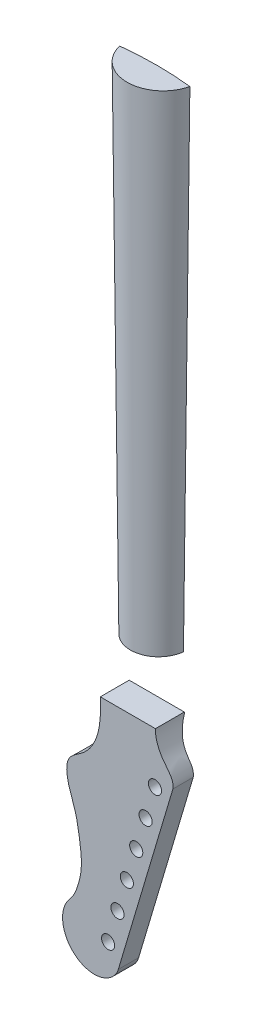
from build123d import *

# Parameters (mm, degrees)
SKETCH7_R               = 5
BOSS_EXTRUDE1_DEPTH     = 22
CUT_EXTRUDE1_DEPTH      = 89
CUT_EXTRUDE1_DEPTH_BACK = 47
FILLET1_R               = 35
FILLET2_START           = 6
FILLET2_DEPTH           = 17


with BuildPart() as part:
    # Sketch4 for Loft1 → Loft1 section 0
    with BuildSketch(Plane(origin=(0, 413.03, 0), x_dir=(1, 0, 0), z_dir=(0, 1, 0))):
        with BuildLine():
            # circular arc as an exact rational Bezier (weights 1, cos(half-angle), 1)
            Bezier((3.411173818, -1.486067363), (30.150054, 1.495276154), (56.888934182, -1.486067363), weights=[1, 0.993841412, 1])
            Bezier((56.888934182, -1.486067363), (30.150054, -113.662589607), (3.411173818, -1.486067363), weights=[1, 0.231868224, 1])
        make_face()
    # Sketch2 for Loft1 → Loft1 section 1
    with BuildSketch(Plane(origin=(0, 37.07, 0), x_dir=(1, 0, 0), z_dir=(0, 1, 0))):
        with BuildLine():
            Bezier((51.441561571, -0.941181345), (30.150054, 0.944866761), (8.858546429, -0.941181345), weights=[1, 0.996099539, 1])
            Bezier((8.858546429, -0.941181345), (30.150054, -192.779980086), (51.441561571, -0.941181345), weights=[1, 0.110309138, 1])
        make_face()
    loft()


with BuildPart() as body_2:
    # Sketch7 → Boss-Extrude1 (new body)
    with BuildSketch(Plane.XY):
        with BuildLine():
            Line((61.822469128, -45.279185569), (26.122769128, -165.279185569))
            Line((26.122769128, -165.279185569), (22.169953883, -178.566071157))
            add(Edge.make_bspline(
                [(-14.363516024, -148.632447047), (-29.983708853, -166.866419634), (-10.052911221, -183.196678053), (9.877886411, -199.526936472), (22.169953883, -178.566071157)],
                knots=[3.45985968, 3.45985968, 3.45985968, 5.114245342, 5.114245342, 6.768631003, 6.768631003, 6.768631003], degree=2, weights=[1, 0.676944597, 1, 0.676944597, 1]))
            ThreePointArc((-14.363516024, -148.632447047), (-10.69288163, -143.264136434), (-8.26535198, -137.230943622))
            add(Edge.make_bspline(
                [(9.14908, -15.846186083), (8.813826518, -24.400453935), (5.670137635, -42.713883785), (-21.244829391, -56.657182906), (-10.241238044, -86.8971503), (-8.604581344, -92.570992516), (-3.490987251, -123.919790761), (-6.829553094, -132.1214282), (-8.26535198, -137.230943622)],
                knots=[0, 0, 0, 0, 0.241122102, 0.315889977, 0.476811467, 0.625347755, 0.735303781, 0.929974714, 0.929974714, 0.929974714, 0.929974714], degree=3))
            Line((9.14908, -15.846186083), (9.14908, -3.25))
            Line((9.14908, -3.25), (51.151028, -3.25))
            add(Edge.make_bspline(
                [(51.151028, -3.25), (50.937550111, -10.767323465), (56.483762161, -22.000731952), (65.296265302, -30.566236086), (64.46789676, -36.386917125)],
                knots=[0, 0, 0, 0, 0.598162067, 1, 1, 1, 1], degree=3))
            Line((64.46789676, -36.386917125), (61.822469128, -45.279185569))
        make_face()
        with Locations((50.799904, -42)):
            Circle(SKETCH7_R, mode=Mode.SUBTRACT)
        with Locations((43.659964, -66)):
            Circle(SKETCH7_R, mode=Mode.SUBTRACT)
        with Locations((36.520024, -90)):
            Circle(SKETCH7_R, mode=Mode.SUBTRACT)
        with Locations((29.380084, -114)):
            Circle(SKETCH7_R, mode=Mode.SUBTRACT)
        with Locations((22.240144, -138)):
            Circle(SKETCH7_R, mode=Mode.SUBTRACT)
        with Locations((15.100204, -162)):
            Circle(SKETCH7_R, mode=Mode.SUBTRACT)
    extrude(amount=BOSS_EXTRUDE1_DEPTH)

    # Sketch9 → Cut-Extrude1 (cut, two sides: drawn at the far end of the back side and taken through both)
    with BuildSketch(Plane(origin=(0, 0, 0), x_dir=(0, 0, -1), z_dir=(1, 0, 0)).offset(-CUT_EXTRUDE1_DEPTH_BACK)):
        Polygon((0, -4.75), (0, -188.619559547), (-6.5, -188.619559547), (-6.5, -21.683078921), align=None)
    extrude(amount=CUT_EXTRUDE1_DEPTH + CUT_EXTRUDE1_DEPTH_BACK, mode=Mode.SUBTRACT)

    # Fillet1
    fillet1_edges = [body_2.edges().sort_by_distance(p)[0] for p in [
        (33.098498215, -21.683078921, 6.5),
    ]]
    fillet(fillet1_edges, radius=FILLET1_R)

    # Fillet2: read off the stored shape, not the designer's step
    # Fillet2 outline → Fillet2 (cut)
    with BuildSketch(Plane.XY.offset(FILLET2_START)):
        with BuildLine():
            Line((22.169953883, -178.566071157), (22.850975257, -176.276904444))
            ThreePointArc((22.850975257, -176.276904444), (21.491301478, -179.452388519), (19.441266868, -182.232634909))
            add(Edge.make_bspline(
                [(19.441266868, -182.232634909), (20.998606375, -180.56349408), (22.169953883, -178.566071157)],
                knots=[6.545874557, 6.545874557, 6.545874557, 6.768631003, 6.768631003, 6.768631003], degree=2, weights=[0.92471745, 0.956501876, 1]))
        make_face()
    extrude(amount=FILLET2_DEPTH, mode=Mode.SUBTRACT)


solid = Compound([part.part, body_2.part])
